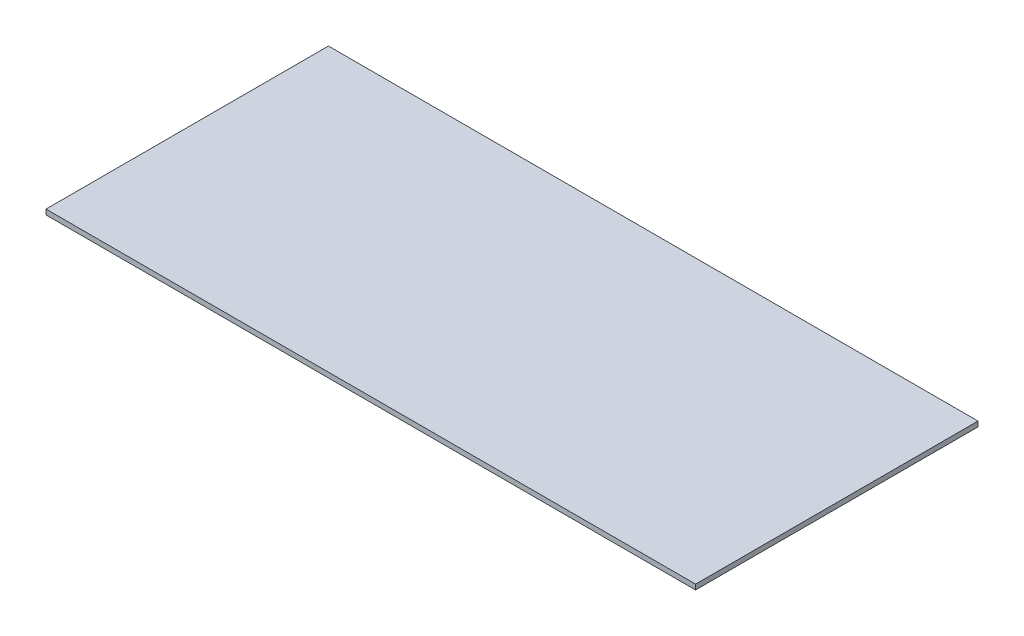
from build123d import *

# Parameters (mm, degrees)
SKETCH1_W           = 2300
SKETCH1_H           = 1000
BOSS_EXTRUDE1_DEPTH = 18


with BuildPart() as part:
    # Sketch1 → Boss-Extrude1 (new body)
    with BuildSketch(Plane(origin=(0, 0, 0), x_dir=(1, 0, 0), z_dir=(0, 1, 0))):
        with Locations((1150, 500)):
            Rectangle(SKETCH1_W, SKETCH1_H)
    extrude(amount=BOSS_EXTRUDE1_DEPTH)


solid = part.part
